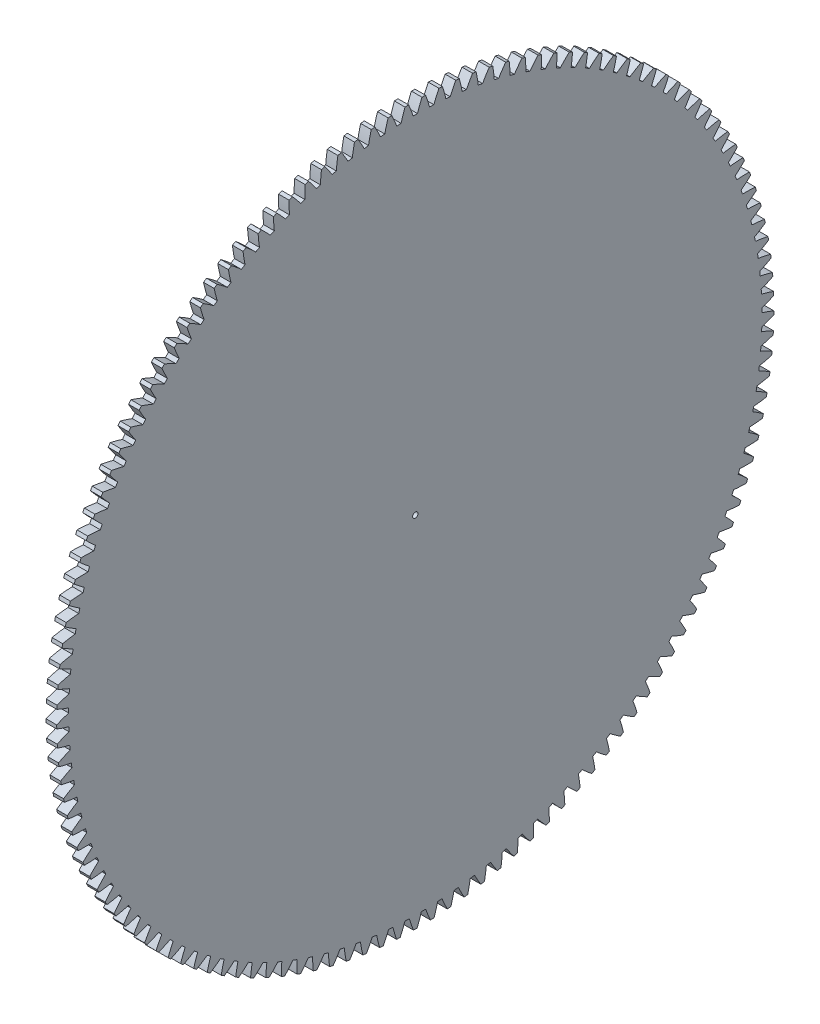
from build123d import *

# Parameters (mm, degrees)
BASPROSKE_W     = 2
BASPROSKE_H     = 67.5
TOOTHCUT_DEPTH  = 96.480364474
TEETHCUTS_COUNT = 133
TEETHCUTS_ANGLE = 357.293233083
BORSKE_R        = 0.5
BORE_DEPTH      = 50.0000508


with BuildPart() as part:
    # BasProSke → Base-Revolve (revolve)
    with BuildSketch(Plane(origin=(0, 0, 0), x_dir=(1, 0, 0), z_dir=(0, 1, 0))):
        with Locations((1, 33.75)):
            Rectangle(BASPROSKE_W, BASPROSKE_H)
    revolve(axis=Axis((-10, 0, 0), (1, 0, 0)))

    # TooCutSke → ToothCut (cut, through all)
    with BuildSketch(Plane(origin=(0, 0, 0), x_dir=(0, 0, -1), z_dir=(1, 0, 0))):
        with BuildLine():
            ThreePointArc((0.408759038, 65.247719631), (0, 65.249), (-0.408759038, 65.247719631))
            ThreePointArc((-0.408759038, 65.247719631), (-0.812169844, 66.3903935), (-1.267204356, 67.513508561))
            ThreePointArc((-1.267204356, 67.513508561), (0, 67.5254), (1.267204356, 67.513508561))
            ThreePointArc((1.267204356, 67.513508561), (0.812169844, 66.3903935), (0.408759038, 65.247719631))
        make_face()
    toothcut = extrude(amount=TOOTHCUT_DEPTH, mode=Mode.SUBTRACT)

    # TeethCuts: ToothCut ×133 about axis
    teethcuts_axis = Axis((-10, 0, 0), (1, 0, 0))
    for i in range(1, TEETHCUTS_COUNT):
        add(toothcut.rotate(teethcuts_axis, i * TEETHCUTS_ANGLE / (TEETHCUTS_COUNT - 1)), mode=Mode.SUBTRACT)

    # BorSke → Bore (cut, symmetric)
    with BuildSketch(Plane(origin=(0, 0, 0), x_dir=(0, 0, -1), z_dir=(1, 0, 0))):
        Circle(BORSKE_R)
    extrude(amount=BORE_DEPTH, both=True, mode=Mode.SUBTRACT)


solid = part.part
